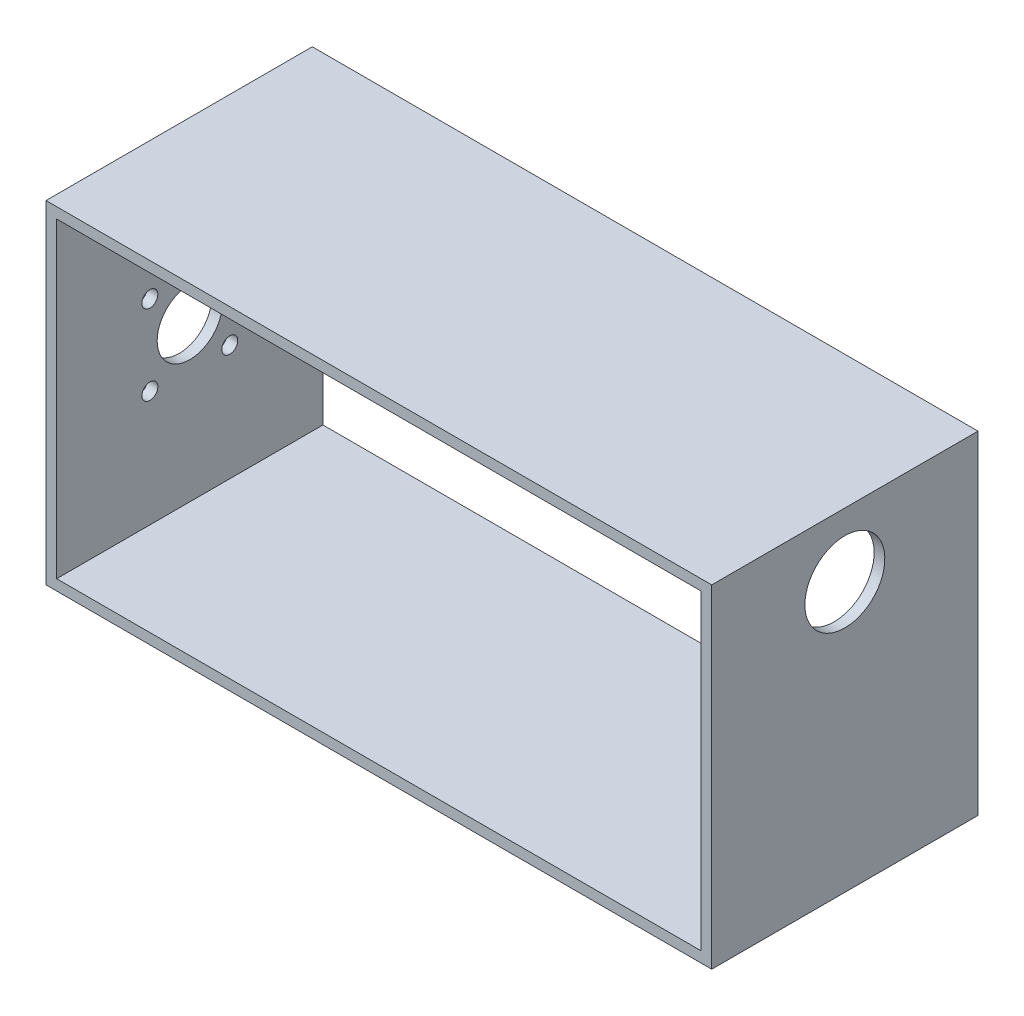
from build123d import *

# Parameters (mm, degrees)
SKIZZE1_W                       = 250
SKIZZE1_H                       = 125
SKIZZE1_W_2                     = 242
SKIZZE1_H_2                     = 117
AUFSATZ_LINEAR_AUSTRAGEN1_DEPTH = 100
SKIZZE2_R                       = 12.25
SCHNITT_LINEAR_AUSTRAGEN1_DEPTH = 10
SKIZZE3_R                       = 15
SCHNITT_LINEAR_AUSTRAGEN2_DEPTH = 10
SKIZZE4_R                       = 3
SCHNITT_LINEAR_AUSTRAGEN3_DEPTH = 10


with BuildPart() as part:
    # Skizze1 → Aufsatz-Linear austragen1 (new body)
    with BuildSketch(Plane.XY):
        with Locations((125, 62.5)):
            Rectangle(SKIZZE1_W, SKIZZE1_H)
        with Locations((125, 62.5)):
            Rectangle(SKIZZE1_W_2, SKIZZE1_H_2, mode=Mode.SUBTRACT)
    extrude(amount=AUFSATZ_LINEAR_AUSTRAGEN1_DEPTH)

    # Skizze2 → Schnitt-Linear austragen1 (cut)
    with BuildSketch(Plane.ZY):
        with Locations((50, 62.5)):
            Circle(SKIZZE2_R)
    extrude(amount=-SCHNITT_LINEAR_AUSTRAGEN1_DEPTH, mode=Mode.SUBTRACT)

    # Skizze3 → Schnitt-Linear austragen2 (cut)
    with BuildSketch(Plane.ZY.offset(-246)):
        with Locations((50, 101)):
            Circle(SKIZZE3_R)
    extrude(amount=-SCHNITT_LINEAR_AUSTRAGEN2_DEPTH, mode=Mode.SUBTRACT)

    # Skizze4 → Schnitt-Linear austragen3 (cut)
    with BuildSketch(Plane.ZY):
        with Locations((35, 77.5)):
            Circle(SKIZZE4_R)
        with Locations((65, 77.5)):
            Circle(SKIZZE4_R)
        with Locations((65, 47.5)):
            Circle(SKIZZE4_R)
        with Locations((35, 47.5)):
            Circle(SKIZZE4_R)
    extrude(amount=-SCHNITT_LINEAR_AUSTRAGEN3_DEPTH, mode=Mode.SUBTRACT)


solid = part.part
